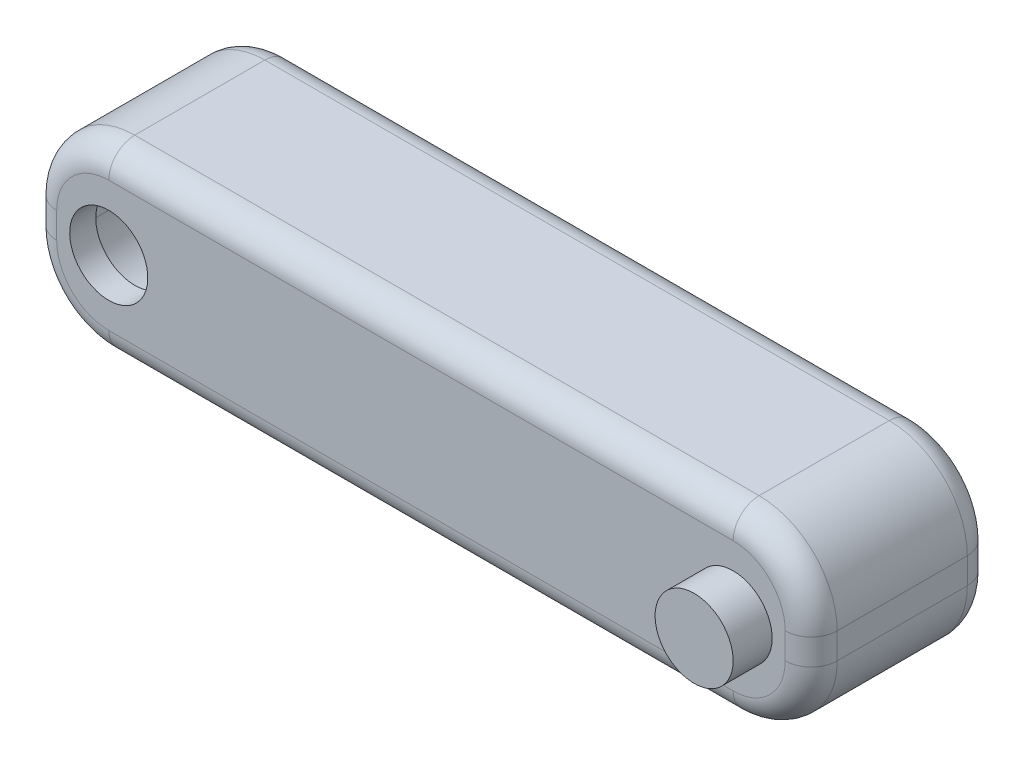
from build123d import *

# Parameters (mm, degrees)
SKETCH2_W           = 70
SKETCH2_H           = 70
BOSS_EXTRUDE1_DEPTH = 300
FILLET1_R           = 30
FILLET2_R           = 10
SHELL1_START        = -25
SHELL1_DEPTH        = 50
SKETCH3_R           = 15
BOSS_EXTRUDE2_DEPTH = 15
CUT_EXTRUDE1_START  = -30
SKETCH4_R           = 15
CUT_EXTRUDE1_DEPTH  = 30


# Read off the part's stored shape, not the designer's step: Shell1
with BuildPart() as part:
    # Sketch2 → Boss-Extrude1 (new body)
    with BuildSketch(Plane(origin=(0, 0, 0), x_dir=(0, 0, -1), z_dir=(1, 0, 0))):
        Rectangle(SKETCH2_W, SKETCH2_H)
    extrude(amount=BOSS_EXTRUDE1_DEPTH)

    # Fillet1
    fillet1_edges = [part.edges().sort_by_distance(p)[0] for p in [
        (300, 35, 0),
        (0, 35, 0),
        (0, -35, 0),
        (300, -35, 0),
    ]]
    fillet(fillet1_edges, radius=FILLET1_R)

    # Fillet2
    fillet2_edges = [part.edges().sort_by_distance(p)[0] for p in [
        (150, -35, -35),
        (150, -35, 35),
        (0, 0, -35),
        (150, 35, -35),
        (300, 0, -35),
        (291.213203436, 26.213203436, -35),
        (291.213203436, -26.213203436, -35),
        (8.786796564, 26.213203436, -35),
        (8.786796564, -26.213203436, -35),
        (0, 0, 35),
        (300, 0, 35),
        (150, 35, 35),
        (291.213203436, 26.213203436, 35),
        (291.213203436, -26.213203436, 35),
        (8.786796564, 26.213203436, 35),
        (8.786796564, -26.213203436, 35),
    ]]
    fillet(fillet2_edges, radius=FILLET2_R)

    # Shell1 outline → Shell1 (cut)
    with BuildSketch(Plane.XY.offset(SHELL1_START)):
        with BuildLine():
            Line((30, -25), (270, -25))
            ThreePointArc((270, -25), (284.142135624, -19.142135624), (290, -5))
            Line((290, -5), (290, 5))
            ThreePointArc((290, 5), (284.142135624, 19.142135624), (270, 25))
            Line((270, 25), (30, 25))
            ThreePointArc((30, 25), (15.857864376, 19.142135624), (10, 5))
            Line((10, 5), (10, -5))
            ThreePointArc((10, -5), (15.857864376, -19.142135624), (30, -25))
        make_face()
    extrude(amount=SHELL1_DEPTH, mode=Mode.SUBTRACT)

    # Sketch3 → Boss-Extrude2 (add)
    with BuildSketch(Plane.XY.offset(35)):
        with Locations(Location((30, 0, 0), (0, 0, 90))):
            Circle(SKETCH3_R)
        with Locations(Location((270, 0, 0), (0, 0, 90))):
            Circle(SKETCH3_R)
    extrude(amount=BOSS_EXTRUDE2_DEPTH)

    # Sketch4 → Cut-Extrude1 (cut)
    with BuildSketch(Plane.XY.offset(50).offset(CUT_EXTRUDE1_START)):
        with Locations(Location((30, 0, 0), (0, 0, 90))):
            Circle(SKETCH4_R)
    extrude(amount=CUT_EXTRUDE1_DEPTH, mode=Mode.SUBTRACT)


solid = part.part
